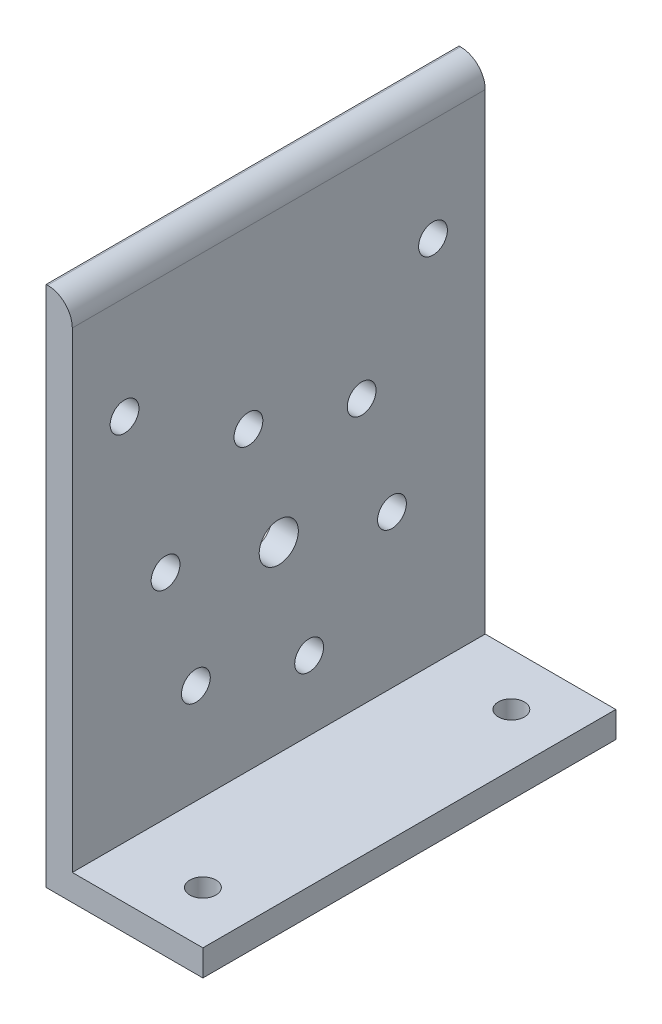
from build123d import *

# Parameters (mm, degrees)
BOSS_EXTRUDE1_DEPTH     = 100.4
CUT_EXTRUDE1_DEPTH      = 167.315272901
CUT_EXTRUDE1_DEPTH_BACK = 167.315272901
SKETCH2_R               = 4.7625
SKETCH2_R_2             = 3.5
SKETCH3_R               = 3.175
CUT_EXTRUDE2_DEPTH      = 162.518396785
SKETCH5_R               = 3.5
CUT_EXTRUDE4_DEPTH      = 10


with BuildPart() as part:
    # Sketch1 → Boss-Extrude1 (new body)
    with BuildSketch(Plane.XY):
        with BuildLine():
            Line((0, 6.35), (0, 0))
            Line((0, 0), (38.1, 0))
            Line((38.1, 0), (38.1, 0.35))
            Line((38.1, 0.35), (38.1, 6.35))
            Line((38.1, 6.35), (32.1, 6.35))
            Line((32.1, 6.35), (6.35, 6.35))
            Line((6.35, 6.35), (6.35, 37.75))
            Line((6.35, 37.75), (6.35, 121))
            ThreePointArc((6.35, 121), (4.592640687, 125.242640687), (0.35, 127))
            Line((0.35, 127), (0, 127))
            Line((0, 127), (0, 6.35))
        make_face()
    extrude(amount=BOSS_EXTRUDE1_DEPTH)

    # Sketch2 → Cut-Extrude1 (cut, two sides: drawn at the far end of the back side and taken through both)
    with BuildSketch(Plane.ZY.offset(-CUT_EXTRUDE1_DEPTH_BACK)):
        with Locations((50.2, 50.8)):
            Circle(SKETCH2_R)
        with Locations((57.576342785, 78.328886049)):
            Circle(SKETCH2_R_2)
        with Locations((30.047456736, 70.952543264)):
            Circle(SKETCH2_R_2)
        with Locations((22.671113951, 43.423657215)):
            Circle(SKETCH2_R_2)
        with Locations((42.823657215, 23.271113951)):
            Circle(SKETCH2_R_2)
        with Locations((70.352543264, 30.647456736)):
            Circle(SKETCH2_R_2)
        with Locations((77.728886049, 58.176342785)):
            Circle(SKETCH2_R_2)
    extrude(amount=CUT_EXTRUDE1_DEPTH + CUT_EXTRUDE1_DEPTH_BACK, mode=Mode.SUBTRACT)

    # Sketch3 → Cut-Extrude2 (cut, through all)
    with BuildSketch(Plane(origin=(0, 6.35, 0), x_dir=(1, 0, 0), z_dir=(0, 1, 0))):
        with Locations((25.4, -12.7)):
            Circle(SKETCH3_R)
        with Locations((25.4, -87.7)):
            Circle(SKETCH3_R)
    extrude(amount=-CUT_EXTRUDE2_DEPTH, mode=Mode.SUBTRACT)

    # Sketch5 → Cut-Extrude4 (cut)
    with BuildSketch(Plane(origin=(6.35, 0, 0), x_dir=(0, 0, -1), z_dir=(1, 0, 0))):
        with Locations((-87.7, 96)):
            Circle(SKETCH5_R)
        with Locations((-12.7, 96)):
            Circle(SKETCH5_R)
    extrude(amount=-CUT_EXTRUDE4_DEPTH, mode=Mode.SUBTRACT)


solid = part.part
